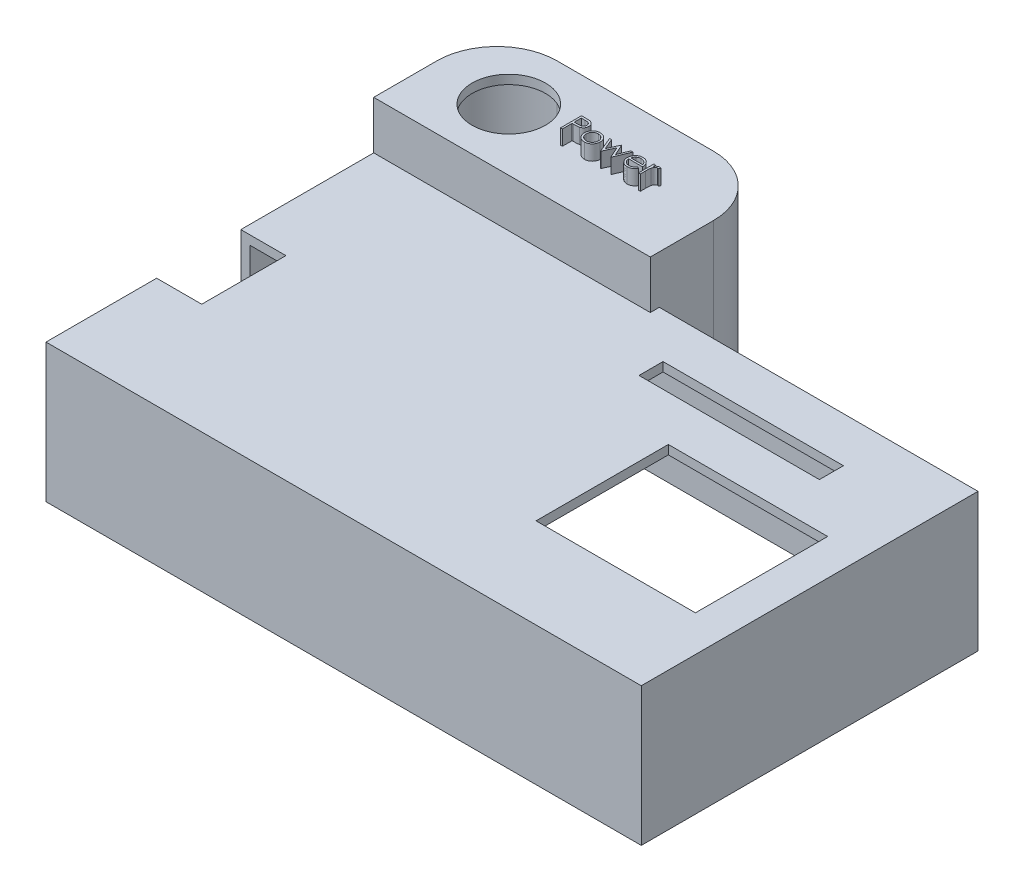
from build123d import *

# Parameters (mm, degrees)
SKETCH1_W           = 99
SKETCH1_H           = 56
BOSS_EXTRUDE1_DEPTH = 23
SKETCH3_W           = 96
SKETCH3_H           = 53
CUT_EXTRUDE1_DEPTH  = 21.5
SKETCH4_W           = 7.5
SKETCH4_H           = 14
CUT_EXTRUDE4_DEPTH  = 11
BOSS_EXTRUDE5_DEPTH = 31
CUT_EXTRUDE8_DEPTH  = 29.5
SKETCH16_W          = 37.752580564
SKETCH16_H          = 16
CUT_EXTRUDE10_DEPTH = 2
SKETCH17_R          = 6.1
CUT_EXTRUDE11_DEPTH = 2
BOSS_EXTRUDE6_DEPTH = 2.5
SKETCH19_W          = 26.5
SKETCH19_H          = 22
CUT_EXTRUDE12_DEPTH = 2
SKETCH20_W          = 30
SKETCH20_H          = 4
CUT_EXTRUDE13_DEPTH = 2


with BuildPart() as part:
    # Sketch1 → Boss-Extrude1 (new body)
    with BuildSketch(Plane(origin=(0, 0, 0), x_dir=(1, 0, 0), z_dir=(0, 1, 0))):
        Rectangle(SKETCH1_W, SKETCH1_H)
    extrude(amount=BOSS_EXTRUDE1_DEPTH)

    # Sketch3 → Cut-Extrude1 (cut)
    with BuildSketch(Plane.XZ):
        Rectangle(SKETCH3_W, SKETCH3_H)
    extrude(amount=-CUT_EXTRUDE1_DEPTH, mode=Mode.SUBTRACT)

    # Sketch4 → Cut-Extrude4 (cut)
    with BuildSketch(Plane(origin=(0, 23, 0), x_dir=(1, 0, 0), z_dir=(0, 1, 0))):
        with Locations((-45.75, -2.6)):
            Rectangle(SKETCH4_W, SKETCH4_H)
    extrude(amount=-CUT_EXTRUDE4_DEPTH, mode=Mode.SUBTRACT)

    # Sketch9 → Boss-Extrude5 (add)
    with BuildSketch(Plane.XZ):
        with BuildLine():
            Line((-3.5, -26.5), (-49.5, -26.5))
            Line((-49.5, -26.5), (-49.5, -37))
            ThreePointArc((-49.5, -37), (-46.571067812, -44.071067812), (-39.5, -47))
            Line((-39.5, -47), (-13.5, -47))
            ThreePointArc((-13.5, -47), (-6.428932188, -44.071067812), (-3.5, -37))
            Line((-3.5, -37), (-3.5, -26.5))
        make_face()
    extrude(amount=-BOSS_EXTRUDE5_DEPTH)

    # Sketch14 → Cut-Extrude8 (cut)
    with BuildSketch(Plane(origin=(0, 0, 0), x_dir=(-1, 0, 0), z_dir=(0, -1, 0))):
        with BuildLine():
            Line((5, 28), (48, 28))
            Line((48, 28), (48, 35.5))
            ThreePointArc((48, 35.5), (45.071067812, 42.571067812), (38, 45.5))
            Line((38, 45.5), (15, 45.5))
            ThreePointArc((15, 45.5), (7.928932188, 42.571067812), (5, 35.5))
            Line((5, 35.5), (5, 28))
        make_face()
    extrude(amount=-CUT_EXTRUDE8_DEPTH, mode=Mode.SUBTRACT)

    # Sketch16 → Cut-Extrude10 (cut)
    with BuildSketch(Plane.XY.offset(-26.5)):
        with Locations((-27.111178413, 12)):
            Rectangle(SKETCH16_W, SKETCH16_H)
    extrude(amount=-CUT_EXTRUDE10_DEPTH, mode=Mode.SUBTRACT)

    # Sketch17 → Cut-Extrude11 (cut)
    with BuildSketch(Plane(origin=(0, 29.5, 0), x_dir=(-1, 0, 0), z_dir=(0, -1, 0))):
        with Locations((37.281553398, 36.75)):
            Circle(SKETCH17_R)
    extrude(amount=-CUT_EXTRUDE11_DEPTH, mode=Mode.SUBTRACT)

    # Sketch18 → Boss-Extrude6 (add)
    # profile 1 of 5: a face of its own
    with BuildSketch(Plane(origin=(0, 31, 0), x_dir=(1, 0, 0), z_dir=(0, 1, 0))):
        with BuildLine():
            Line((-27.068619083, 38.631067961), (-26.382220846, 38.631067961))
            add(Edge.make_bspline(
                [(-26.382220846, 38.631067961), (-26.33500994, 38.631016065), (-26.244551747, 38.630916629), (-26.114836691, 38.627901884), (-25.99702696, 38.623875192), (-25.891376579, 38.618293298), (-25.797560481, 38.611696708), (-25.716003181, 38.602444669), (-25.646063625, 38.592784373), (-25.604157175, 38.582962967), (-25.585045365, 38.578483827)],
                knots=[0, 0, 0, 0, 1.415646017, 2.712440637, 3.8905458, 4.950247383, 5.884950622, 6.709939814, 7.411656543, 8, 8, 8, 8], degree=3))
            add(Edge.make_bspline(
                [(-25.585045365, 38.578483827), (-25.560851831, 38.571861877), (-25.513034854, 38.558774015), (-25.444133811, 38.532560292), (-25.378579966, 38.501478126), (-25.316148407, 38.466054187), (-25.257606324, 38.424768622), (-25.202080283, 38.379295005), (-25.150060303, 38.328583436), (-25.101838911, 38.273202696), (-25.057554113, 38.214082486), (-25.019424431, 38.150340256), (-24.987497204, 38.083048953), (-24.960113932, 38.012255382), (-24.940405478, 37.937365058), (-24.925558578, 37.858898346), (-24.91613495, 37.776863656), (-24.915232389, 37.720803788), (-24.914772929, 37.692265878)],
                knots=[0, 0, 0, 0, 0.999701418, 1.975846123, 2.934577507, 3.890451536, 4.834027766, 5.787354733, 6.749476667, 7.726910423, 8.712836071, 9.690891519, 10.682875813, 11.679750201, 12.712814741, 13.765529915, 14.8625177, 16, 16, 16, 16], degree=3))
            add(Edge.make_bspline(
                [(-24.914772929, 37.692265878), (-24.915194354, 37.663488101), (-24.9160189, 37.607182437), (-24.925915185, 37.524809649), (-24.939245377, 37.446091259), (-24.959742429, 37.371201808), (-24.986588102, 37.300586038), (-25.018080155, 37.233164806), (-25.056063686, 37.170085134), (-25.099708515, 37.111118016), (-25.14826011, 37.056208104), (-25.201513048, 37.00575331), (-25.25925234, 36.960048971), (-25.321294488, 36.918992627), (-25.388244337, 36.883536348), (-25.459086491, 36.851779043), (-25.534436707, 36.825107982), (-25.586579221, 36.811077921), (-25.613090237, 36.803944564)],
                knots=[0, 0, 0, 0, 1.121902311, 2.195077645, 3.232258892, 4.234102512, 5.217864754, 6.176164875, 7.132989551, 8.084763148, 9.034132444, 9.988522005, 10.94243251, 11.903244335, 12.886203696, 13.894208494, 14.929344452, 16, 16, 16, 16], degree=3))
            add(Edge.make_bspline(
                [(-25.613090237, 36.803944564), (-25.635017571, 36.799281583), (-25.683072598, 36.789062388), (-25.762215321, 36.777653932), (-25.854360706, 36.767916331), (-25.959382986, 36.760615193), (-26.077187891, 36.754364825), (-26.207839149, 36.749396731), (-26.351593226, 36.746666877), (-26.45186447, 36.746526084), (-26.504216038, 36.746452577)],
                knots=[0, 0, 0, 0, 0.601384939, 1.31797006, 2.144135048, 3.087295005, 4.142315834, 5.309527816, 6.595305764, 8, 8, 8, 8], degree=3))
            Line((-26.504216038, 36.746452577), (-26.754516519, 36.746452577))
            Line((-26.754516519, 36.746452577), (-26.754516519, 35.131067961))
            Line((-26.754516519, 35.131067961), (-27.068619083, 35.131067961))
            Line((-27.068619083, 35.131067961), (-27.068619083, 38.631067961))
        make_face()
        with BuildLine():
            Line((-26.754516519, 38.272093602), (-26.754516519, 37.105426936))
            Line((-26.754516519, 37.105426936), (-26.14173607, 37.097714596))
            add(Edge.make_bspline(
                [(-26.14173607, 37.097714596), (-26.111816145, 37.097699132), (-26.054056345, 37.09766928), (-25.970620121, 37.101654504), (-25.893210834, 37.106255036), (-25.822066259, 37.11299096), (-25.757154324, 37.122512217), (-25.698366795, 37.132123955), (-25.646159512, 37.146029318), (-25.585060311, 37.164752387), (-25.516976963, 37.196685002), (-25.442909415, 37.243034893), (-25.380138828, 37.302115601), (-25.325820532, 37.368543432), (-25.282714654, 37.442442561), (-25.251158661, 37.521511498), (-25.232617504, 37.604939348), (-25.23013131, 37.662027487), (-25.228875493, 37.690863634)],
                knots=[0, 0, 0, 0, 1.160613943, 2.240541288, 3.23993089, 4.169200891, 5.011653406, 5.7853311, 6.478053781, 7.106038997, 8.262395093, 9.384106736, 10.481365981, 11.59014053, 12.70357646, 13.786202915, 14.881775077, 16, 16, 16, 16], degree=3))
            add(Edge.make_bspline(
                [(-25.228875493, 37.690863634), (-25.23013814, 37.719002148), (-25.232648125, 37.77493803), (-25.251303988, 37.85691679), (-25.282653302, 37.935152495), (-25.326109896, 38.00812558), (-25.378851026, 38.074314384), (-25.44015037, 38.131811511), (-25.509863631, 38.178033214), (-25.574711862, 38.207866496), (-25.632313048, 38.226081771), (-25.682345008, 38.238826611), (-25.738835682, 38.249002218), (-25.801803462, 38.257241721), (-25.870760296, 38.264295182), (-25.946298611, 38.269081159), (-26.028132254, 38.271882615), (-26.084942825, 38.27202157), (-26.11439232, 38.272093602)],
                knots=[0, 0, 0, 0, 1.120700087, 2.227813068, 3.331159281, 4.466773991, 5.599788987, 6.693661531, 7.80175334, 8.91857717, 9.525282508, 10.207424825, 10.974604443, 11.810962634, 12.737642355, 13.736264703, 14.826523623, 16, 16, 16, 16], degree=3))
            Line((-26.11439232, 38.272093602), (-26.754516519, 38.272093602))
        make_face(mode=Mode.SUBTRACT)
    # profile 2 of 5: a face of its own
    with BuildSketch(Plane(origin=(0, 31, 0), x_dir=(1, 0, 0), z_dir=(0, 1, 0))):
        with BuildLine():
            add(Edge.make_bspline(
                [(-23.051191199, 37.733632064), (-23.003199926, 37.732610173), (-22.909100768, 37.730606494), (-22.771292882, 37.709191528), (-22.639747746, 37.676444164), (-22.513961554, 37.631172602), (-22.395545259, 37.570490651), (-22.282774015, 37.49808136), (-22.175957006, 37.412298766), (-22.111933976, 37.345940698), (-22.079436391, 37.312257865)],
                knots=[0, 0, 0, 0, 1.054011418, 2.066658804, 3.057071809, 4.030435133, 4.997543892, 5.974964718, 6.972108034, 8, 8, 8, 8], degree=3))
            add(Edge.make_bspline(
                [(-22.079436391, 37.312257865), (-22.051454437, 37.280043879), (-21.996032057, 37.216239337), (-21.924966338, 37.112783724), (-21.863744778, 37.005643623), (-21.814681817, 36.893396297), (-21.775996793, 36.777021626), (-21.748531097, 36.656119614), (-21.732194162, 36.530957267), (-21.729991195, 36.445953429), (-21.728875493, 36.402902897)],
                knots=[0, 0, 0, 0, 1.025258237, 2.030674902, 3.01204498, 3.988269485, 4.97094183, 5.956517959, 6.965070386, 8, 8, 8, 8], degree=3))
            add(Edge.make_bspline(
                [(-21.728875493, 36.402902897), (-21.729856831, 36.359602839), (-21.731795999, 36.274039906), (-21.750139615, 36.14802054), (-21.778670701, 36.025825718), (-21.81950254, 35.907967024), (-21.871860649, 35.794084196), (-21.935751336, 35.684674647), (-22.011622953, 35.579522514), (-22.09762695, 35.479520676), (-22.192678826, 35.387354461), (-22.295794975, 35.307026191), (-22.404949008, 35.238204667), (-22.521592362, 35.182768251), (-22.644659849, 35.139058551), (-22.774416917, 35.108358535), (-22.910661987, 35.089796851), (-23.003689208, 35.087413278), (-23.051191199, 35.086196166)],
                knots=[0, 0, 0, 0, 0.998656419, 1.973391657, 2.932242238, 3.890759089, 4.846373663, 5.82037756, 6.809684879, 7.83454468, 8.860553229, 9.859544525, 10.845671541, 11.83227036, 12.833544569, 13.85385346, 14.904124723, 16, 16, 16, 16], degree=3))
            add(Edge.make_bspline(
                [(-23.051191199, 35.086196166), (-23.098925918, 35.087417363), (-23.192416778, 35.089809137), (-23.32914276, 35.10828642), (-23.459132379, 35.139044402), (-23.582360977, 35.182911895), (-23.699505824, 35.238206439), (-23.809292321, 35.306818128), (-23.912492237, 35.387378284), (-24.007564221, 35.479514221), (-24.093562826, 35.579524177), (-24.169435835, 35.684674215), (-24.233326161, 35.794084309), (-24.285684365, 35.907966994), (-24.326516178, 36.025825726), (-24.35504727, 36.148020538), (-24.373390885, 36.274039907), (-24.375330053, 36.35960284), (-24.376311391, 36.402902897)],
                knots=[0, 0, 0, 0, 1.099876186, 2.154163076, 3.173186993, 4.173200201, 5.163417411, 6.152872554, 7.150605724, 8.17532212, 9.198891216, 10.186952605, 11.159729845, 12.11414092, 13.071450619, 14.029093627, 15.002601286, 16, 16, 16, 16], degree=3))
            add(Edge.make_bspline(
                [(-24.376311391, 36.402902897), (-24.375188081, 36.445719443), (-24.372964119, 36.530488845), (-24.35664361, 36.655415906), (-24.329285054, 36.776113295), (-24.290553657, 36.892038771), (-24.241038466, 37.003794207), (-24.180677178, 37.111199038), (-24.108886546, 37.214186839), (-24.053684594, 37.277908919), (-24.025750493, 37.3101545)],
                knots=[0, 0, 0, 0, 1.031353054, 2.041901799, 3.029428768, 4.008703097, 4.981709435, 5.96992636, 6.972712378, 8, 8, 8, 8], degree=3))
            add(Edge.make_bspline(
                [(-24.025750493, 37.3101545), (-23.993301902, 37.344129439), (-23.929486039, 37.410947135), (-23.822137311, 37.496479659), (-23.70964349, 37.570395733), (-23.589918564, 37.629871948), (-23.464235706, 37.676710466), (-23.332016463, 37.709275981), (-23.193740948, 37.730529336), (-23.099181327, 37.732587514), (-23.051191199, 37.733632064)],
                knots=[0, 0, 0, 0, 1.027980169, 2.021703884, 2.998553061, 3.971491411, 4.943284454, 5.930300938, 6.949603206, 8, 8, 8, 8], degree=3))
        make_face()
        with BuildLine():
            add(Edge.make_bspline(
                [(-23.052593442, 37.4195295), (-23.086531053, 37.418564908), (-23.153530182, 37.416660625), (-23.252149767, 37.402176721), (-23.347089921, 37.379229217), (-23.438530765, 37.34662516), (-23.526163937, 37.304526261), (-23.61007334, 37.252817901), (-23.69050578, 37.192184945), (-23.765887843, 37.122722273), (-23.835070155, 37.046843279), (-23.895548132, 36.96599492), (-23.946973238, 36.881488573), (-23.989813397, 36.793236362), (-24.021720585, 36.700343948), (-24.044893608, 36.603863317), (-24.059363848, 36.503597901), (-24.061250227, 36.435436882), (-24.062208827, 36.400799532)],
                knots=[0, 0, 0, 0, 1.021534396, 2.016698045, 2.994645724, 3.958388632, 4.93408049, 5.916473867, 6.921342795, 7.962252576, 8.998418191, 10.008913653, 10.997312074, 11.973003931, 12.956656626, 13.948281152, 14.957379055, 16, 16, 16, 16], degree=3))
            add(Edge.make_bspline(
                [(-24.062208827, 36.400799532), (-24.060602003, 36.356047505), (-24.057412759, 36.267223099), (-24.031477522, 36.136411976), (-23.988091242, 36.010830124), (-23.929503963, 35.891213738), (-23.856097744, 35.78054146), (-23.769610677, 35.681869976), (-23.670970977, 35.596684164), (-23.561354477, 35.526003319), (-23.443000159, 35.469843563), (-23.317743838, 35.430044587), (-23.187103144, 35.404172895), (-23.097822413, 35.401601421), (-23.052593442, 35.40029873)],
                knots=[0, 0, 0, 0, 1.016792936, 2.018143844, 3.017858371, 4.030088057, 5.03801393, 6.028138512, 7.003788237, 7.991172063, 8.984598303, 9.972568034, 10.972917682, 12, 12, 12, 12], degree=3))
            add(Edge.make_bspline(
                [(-23.052593442, 35.40029873), (-23.007367073, 35.401609011), (-22.918091477, 35.404195468), (-22.7876323, 35.429914287), (-22.662718329, 35.470017948), (-22.544486941, 35.525940158), (-22.434920338, 35.596952573), (-22.335571216, 35.68138895), (-22.249822605, 35.780802801), (-22.176489, 35.89136033), (-22.116942258, 36.010644682), (-22.073759056, 36.136435154), (-22.04776147, 36.267217196), (-22.044580641, 36.356045527), (-22.042978058, 36.400799532)],
                knots=[0, 0, 0, 0, 1.02726834, 2.027799167, 3.010890988, 4.004497153, 4.992059811, 5.971914811, 6.958719428, 7.966827853, 8.981595046, 9.981490638, 10.983022906, 12, 12, 12, 12], degree=3))
            add(Edge.make_bspline(
                [(-22.042978058, 36.400799532), (-22.043936328, 36.435437089), (-22.045822057, 36.503598515), (-22.060297021, 36.603860969), (-22.083452561, 36.700352565), (-22.115424178, 36.793204569), (-22.158078192, 36.881717073), (-22.210494985, 36.9657468), (-22.27072601, 37.047123346), (-22.340743131, 37.122476987), (-22.416046509, 37.192212023), (-22.496511547, 37.252841413), (-22.580296526, 37.304299008), (-22.667675109, 37.346985249), (-22.759127676, 37.378932589), (-22.853934805, 37.402309221), (-22.952133615, 37.416599417), (-23.018892658, 37.418546559), (-23.052593442, 37.4195295)],
                knots=[0, 0, 0, 0, 1.042956736, 2.052379634, 3.044323526, 4.02829302, 5.004299113, 5.996692471, 7.007513377, 8.048758398, 9.090003419, 10.095195979, 11.07790575, 12.047570684, 13.018257071, 13.989683339, 14.985167495, 16, 16, 16, 16], degree=3))
        make_face(mode=Mode.SUBTRACT)
    # profile 3 of 5: a face of its own
    with BuildSketch(Plane(origin=(0, 31, 0), x_dir=(1, 0, 0), z_dir=(0, 1, 0))):
        Polygon((-21.459644724, 37.688760269), (-21.123106263, 37.688760269), (-20.36028575, 35.849016679), (-19.526651936, 37.688760269), (-19.472665558, 37.688760269), (-18.655157545, 35.849016679), (-17.886026936, 37.688760269), (-17.55579857, 37.688760269), (-18.625009308, 35.131067961), (-18.689512513, 35.131067961), (-19.507721647, 36.970811551), (-20.341355461, 35.131067961), (-20.398847449, 35.131067961), align=None)
    # profile 4 of 5: a face of its own
    with BuildSketch(Plane(origin=(0, 31, 0), x_dir=(1, 0, 0), z_dir=(0, 1, 0))):
        with BuildLine():
            Line((-15.052793763, 35.938760269), (-14.773747288, 35.792225814))
            add(Edge.make_bspline(
                [(-14.773747288, 35.792225814), (-14.795983884, 35.752782482), (-14.839247492, 35.67604138), (-14.91364824, 35.570609519), (-14.991640313, 35.475761803), (-15.076744281, 35.394032149), (-15.166413959, 35.322780764), (-15.261146614, 35.260442939), (-15.361435432, 35.207324419), (-15.467285157, 35.162571891), (-15.579584708, 35.128162397), (-15.698606224, 35.103858176), (-15.82457772, 35.088834907), (-15.9109239, 35.087089767), (-15.955137513, 35.086196166)],
                knots=[0, 0, 0, 0, 1.120438281, 2.179929193, 3.190490725, 4.156257408, 5.095198341, 6.022838206, 6.959905092, 7.901321166, 8.864066838, 9.862729781, 10.905609505, 12, 12, 12, 12], degree=3))
            add(Edge.make_bspline(
                [(-15.955137513, 35.086196166), (-16.00427949, 35.087343342), (-16.100141252, 35.089581148), (-16.239680999, 35.108873613), (-16.371060417, 35.140345971), (-16.494272121, 35.184311513), (-16.609014373, 35.241738837), (-16.715515228, 35.311698319), (-16.814334754, 35.393830574), (-16.902358963, 35.488847017), (-16.981602846, 35.590528974), (-17.051528666, 35.696484859), (-17.109986097, 35.806448083), (-17.157538707, 35.919718607), (-17.195943572, 36.035582501), (-17.222710276, 36.155093968), (-17.238140024, 36.277929553), (-17.240504469, 36.361026888), (-17.241696006, 36.402902897)],
                knots=[0, 0, 0, 0, 1.145258523, 2.234067595, 3.276747158, 4.290159414, 5.277019952, 6.260822364, 7.254936242, 8.264827045, 9.274100331, 10.257902744, 11.220704747, 12.172965371, 13.118907548, 14.062713208, 15.023725156, 16, 16, 16, 16], degree=3))
            add(Edge.make_bspline(
                [(-17.241696006, 36.402902897), (-17.240636865, 36.442197727), (-17.238537787, 36.520074892), (-17.225306999, 36.635340437), (-17.201858706, 36.747368889), (-17.169682382, 36.856253337), (-17.128131136, 36.961811471), (-17.077298917, 37.064107535), (-17.017106539, 37.163032675), (-16.970633865, 37.225435808), (-16.947224852, 37.256869243)],
                knots=[0, 0, 0, 0, 1.024358464, 2.0301432, 3.019427413, 4.004406732, 4.986367066, 5.972626655, 6.978780325, 8, 8, 8, 8], degree=3))
            add(Edge.make_bspline(
                [(-16.947224852, 37.256869243), (-16.91551717, 37.294738113), (-16.853106223, 37.369276264), (-16.747549868, 37.46721459), (-16.633249671, 37.549258365), (-16.511638045, 37.617265501), (-16.381301571, 37.668939148), (-16.24399228, 37.70744673), (-16.098146694, 37.729024741), (-15.998441473, 37.732072575), (-15.947425173, 37.733632064)],
                knots=[0, 0, 0, 0, 1.030682036, 2.02871468, 2.997146059, 3.962720338, 4.930598197, 5.918074684, 6.934738563, 8, 8, 8, 8], degree=3))
            add(Edge.make_bspline(
                [(-15.947425173, 37.733632064), (-15.894977568, 37.732278015), (-15.792087322, 37.72962168), (-15.642055201, 37.704995346), (-15.500094484, 37.665942792), (-15.36626198, 37.610789001), (-15.240544119, 37.539629449), (-15.123758069, 37.451487608), (-15.013906557, 37.349069521), (-14.949997978, 37.270306311), (-14.917477256, 37.230226615)],
                knots=[0, 0, 0, 0, 1.056321875, 2.072262726, 3.055038591, 4.01806755, 4.982017516, 5.957941055, 6.960871419, 8, 8, 8, 8], degree=3))
            add(Edge.make_bspline(
                [(-14.917477256, 37.230226615), (-14.895350318, 37.200023034), (-14.851243725, 37.139816915), (-14.795996625, 37.041645758), (-14.74803923, 36.938935163), (-14.709706269, 36.830024866), (-14.678666768, 36.716205286), (-14.656209949, 36.596662742), (-14.64304033, 36.47143283), (-14.640451633, 36.386106275), (-14.639131904, 36.342606423)],
                knots=[0, 0, 0, 0, 0.94817472, 1.890038105, 2.849395472, 3.817997239, 4.812318967, 5.836947057, 6.897266129, 8, 8, 8, 8], degree=3))
            Line((-14.639131904, 36.342606423), (-16.927593442, 36.342606423))
            add(Edge.make_bspline(
                [(-16.927593442, 36.342606423), (-16.926053836, 36.308905958), (-16.923026262, 36.242635355), (-16.908911119, 36.145664572), (-16.886662345, 36.053291229), (-16.855393282, 35.966208187), (-16.817526437, 35.88327806), (-16.77114072, 35.805116023), (-16.715801166, 35.732078093), (-16.654075467, 35.663510955), (-16.585368371, 35.602450194), (-16.513085624, 35.547798418), (-16.436192059, 35.501992821), (-16.355293976, 35.464812931), (-16.270522191, 35.435706615), (-16.181849996, 35.415838795), (-16.089451879, 35.402531688), (-16.026466145, 35.401052023), (-15.994400333, 35.40029873)],
                knots=[0, 0, 0, 0, 1.094153842, 2.151609401, 3.174256925, 4.172055639, 5.149267565, 6.128595816, 7.11444997, 8.118368179, 9.117203808, 10.09244225, 11.054858984, 12.015122123, 12.976791628, 13.957293641, 14.960065497, 16, 16, 16, 16], degree=3))
            add(Edge.make_bspline(
                [(-15.994400333, 35.40029873), (-15.963049186, 35.400906787), (-15.900842495, 35.402113288), (-15.808201637, 35.413845199), (-15.71706211, 35.432815475), (-15.627801127, 35.458705465), (-15.542230281, 35.490282317), (-15.462984731, 35.528385174), (-15.390104515, 35.570534921), (-15.321987548, 35.618744596), (-15.255916555, 35.677752783), (-15.190374069, 35.751388504), (-15.120097415, 35.838476032), (-15.076107823, 35.904021698), (-15.052793763, 35.938760269)],
                knots=[0, 0, 0, 0, 0.99110716, 1.966546729, 2.947904876, 3.932708344, 4.903319531, 5.828989031, 6.710028674, 7.56322171, 8.463672341, 9.504779593, 10.677557249, 12, 12, 12, 12], degree=3))
        make_face()
        with BuildLine():
            add(Edge.make_bspline(
                [(-14.953234468, 36.656708987), (-14.964731092, 36.698371861), (-14.986858394, 36.778559481), (-15.033094758, 36.889600372), (-15.085166299, 36.988288273), (-15.14678803, 37.073867906), (-15.216606756, 37.149871419), (-15.297251939, 37.216290004), (-15.387687832, 37.275707455), (-15.487446973, 37.325859954), (-15.593088758, 37.368549813), (-15.70369495, 37.397174929), (-15.816552738, 37.416784471), (-15.892887024, 37.41861058), (-15.931299372, 37.4195295)],
                knots=[0, 0, 0, 0, 1.154881502, 2.222775134, 3.210006277, 4.132804581, 5.035138423, 5.962687519, 6.919655026, 7.923214229, 8.944639381, 9.960483929, 10.97369054, 12, 12, 12, 12], degree=3))
            add(Edge.make_bspline(
                [(-15.931299372, 37.4195295), (-15.96264881, 37.418917828), (-16.024620059, 37.417708682), (-16.115921127, 37.406238553), (-16.203600826, 37.387278708), (-16.288306114, 37.361313751), (-16.368926982, 37.326705149), (-16.447121751, 37.286121922), (-16.520902147, 37.236580338), (-16.567043442, 37.198821483), (-16.590353859, 37.179745846)],
                knots=[0, 0, 0, 0, 1.04873581, 2.073130211, 3.073294108, 4.04793562, 5.032784715, 6.005352987, 6.992311501, 8, 8, 8, 8], degree=3))
            add(Edge.make_bspline(
                [(-16.590353859, 37.179745846), (-16.607047141, 37.16465153), (-16.640830275, 37.134104314), (-16.685970797, 37.081475108), (-16.729191269, 37.024723545), (-16.768524922, 36.961678421), (-16.804602508, 36.893057642), (-16.838362486, 36.819440007), (-16.868748898, 36.740266876), (-16.885845008, 36.685094437), (-16.894640718, 36.656708987)],
                knots=[0, 0, 0, 0, 0.879870761, 1.780643979, 2.707998968, 3.669668524, 4.684282772, 5.740141944, 6.837334558, 8, 8, 8, 8], degree=3))
            Line((-16.894640718, 36.656708987), (-14.953234468, 36.656708987))
        make_face(mode=Mode.SUBTRACT)
    # profile 5 of 5: a face of its own
    with BuildSketch(Plane(origin=(0, 31, 0), x_dir=(1, 0, 0), z_dir=(0, 1, 0))):
        with BuildLine():
            Line((-14.100670365, 37.688760269), (-13.786567801, 37.688760269))
            Line((-13.786567801, 37.688760269), (-13.786567801, 37.312257865))
            add(Edge.make_bspline(
                [(-13.786567801, 37.312257865), (-13.763379042, 37.347313693), (-13.719030721, 37.414357693), (-13.645317792, 37.503026994), (-13.569814461, 37.57644204), (-13.492159274, 37.634945559), (-13.411781174, 37.678758678), (-13.330444222, 37.710851713), (-13.246868752, 37.729829028), (-13.190706828, 37.732362687), (-13.162569404, 37.733632064)],
                knots=[0, 0, 0, 0, 1.2804753, 2.448899062, 3.506932113, 4.484331642, 5.4025378, 6.288909075, 7.142734305, 8, 8, 8, 8], degree=3))
            add(Edge.make_bspline(
                [(-13.162569404, 37.733632064), (-13.140743077, 37.732441537), (-13.095833992, 37.729991951), (-13.027851402, 37.712781127), (-12.95780795, 37.685303104), (-12.912665563, 37.659462881), (-12.889131904, 37.645991839)],
                knots=[0, 0, 0, 0, 0.901110191, 1.854092781, 2.881294221, 4, 4, 4, 4], degree=3))
            Line((-12.889131904, 37.645991839), (-13.061607865, 37.373956583))
            add(Edge.make_bspline(
                [(-13.061607865, 37.373956583), (-13.076716886, 37.380696849), (-13.105396701, 37.393491164), (-13.147351267, 37.408633175), (-13.186032604, 37.41754909), (-13.210676162, 37.418899808), (-13.222164756, 37.4195295)],
                knots=[0, 0, 0, 0, 1.180555205, 2.24091978, 3.179933427, 4, 4, 4, 4], degree=3))
            add(Edge.make_bspline(
                [(-13.222164756, 37.4195295), (-13.24737049, 37.417849462), (-13.29878288, 37.414422673), (-13.374267379, 37.387483865), (-13.447514585, 37.343958625), (-13.505686247, 37.295687513), (-13.5507285, 37.249139716), (-13.582868725, 37.208491313), (-13.612351472, 37.162912682), (-13.640521693, 37.113182998), (-13.666187987, 37.058453152), (-13.690142656, 36.999269938), (-13.711801519, 36.93556481), (-13.724151763, 36.891182289), (-13.730478058, 36.868447769)],
                knots=[0, 0, 0, 0, 1.125678352, 2.296057538, 3.5422874, 4.923748041, 5.663163013, 6.437101912, 7.23742474, 8.08941207, 8.991984279, 9.93940061, 10.944477711, 12, 12, 12, 12], degree=3))
            add(Edge.make_bspline(
                [(-13.730478058, 36.868447769), (-13.735210451, 36.848170595), (-13.745692343, 36.803258197), (-13.75588388, 36.727909672), (-13.765953398, 36.638886013), (-13.773050017, 36.53593942), (-13.779628059, 36.419326976), (-13.783338141, 36.288871031), (-13.786441282, 36.14443768), (-13.786524349, 36.043463326), (-13.786567801, 35.990643282)],
                knots=[0, 0, 0, 0, 0.566838948, 1.255505196, 2.06880316, 3.007127437, 4.065329342, 5.249902469, 6.561414163, 8, 8, 8, 8], degree=3))
            Line((-13.786567801, 35.990643282), (-13.786567801, 35.131067961))
            Line((-13.786567801, 35.131067961), (-14.100670365, 35.131067961))
            Line((-14.100670365, 35.131067961), (-14.100670365, 37.688760269))
        make_face()
    extrude(amount=BOSS_EXTRUDE6_DEPTH)

    # Sketch19 → Cut-Extrude12 (cut)
    with BuildSketch(Plane(origin=(0, 23, 0), x_dir=(1, 0, 0), z_dir=(0, 1, 0))):
        with Locations((30.25, -2)):
            Rectangle(SKETCH19_W, SKETCH19_H)
    extrude(amount=-CUT_EXTRUDE12_DEPTH, mode=Mode.SUBTRACT)

    # Sketch20 → Cut-Extrude13 (cut)
    with BuildSketch(Plane(origin=(0, 23, 0), x_dir=(1, 0, 0), z_dir=(0, 1, 0))):
        with Locations((19.618585298, 18.5)):
            Rectangle(SKETCH20_W, SKETCH20_H)
    extrude(amount=-CUT_EXTRUDE13_DEPTH, mode=Mode.SUBTRACT)


solid = part.part
